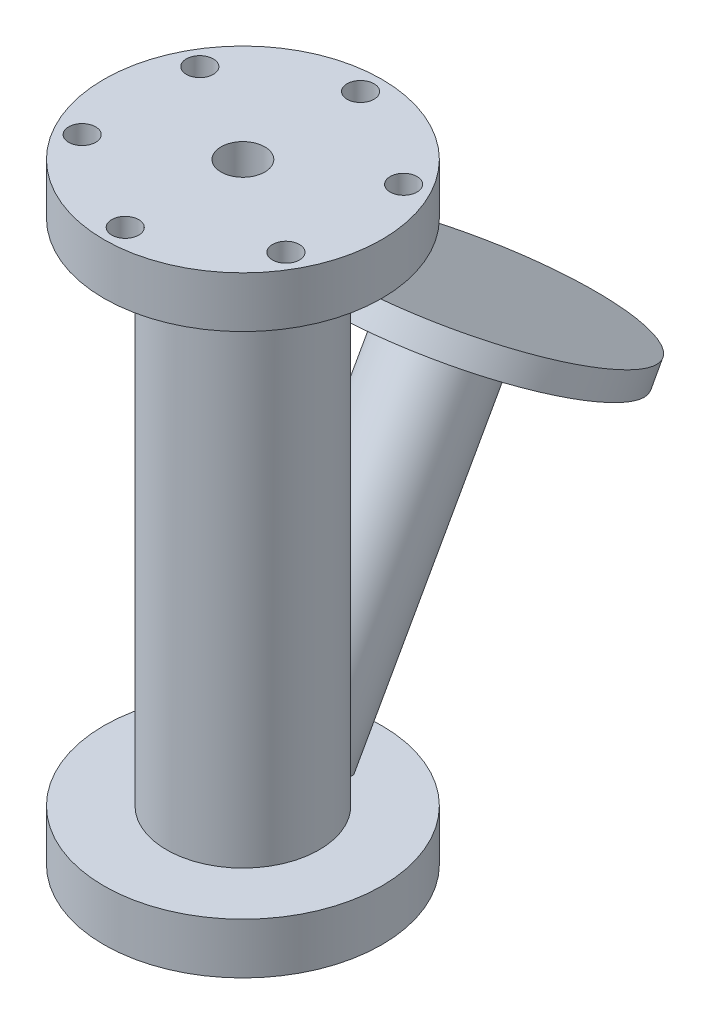
from build123d import *

# Parameters (mm, degrees)
SKETCH1_R         = 19.05
SKETCH1_R_2       = 5.461
EXTRUDE1_DEPTH    = 152.4
SKETCH2_R         = 34.671
SKETCH2_R_2       = 16.51
EXTRUDE2_DEPTH    = 12.7
EXTRUDE3_START    = -12.7
SKETCH3_R         = 34.671
SKETCH3_R_2       = 16.51
EXTRUDE3_DEPTH    = 12.7
SKETCH4_R         = 3.3655
EXTRUDE4_DEPTH    = 149.05487659
CIRPATTERN1_COUNT = 6
SKETCH11_R        = 37.719
EXTRUDE9_DEPTH    = 6.35
SKETCH12_R        = 12.7
EXTRUDE10_DEPTH   = 90.17


with BuildPart() as part:
    # Sketch1 → Extrude1 (new body)
    with BuildSketch(Plane(origin=(0, 0, 0), x_dir=(1, 0, 0), z_dir=(0, 1, 0))):
        Circle(SKETCH1_R)
        Circle(SKETCH1_R_2, mode=Mode.SUBTRACT)
    extrude(amount=EXTRUDE1_DEPTH)

    # Sketch2 → Extrude2 (add)
    with BuildSketch(Plane.XZ):
        Circle(SKETCH2_R)
        Circle(SKETCH2_R_2, mode=Mode.SUBTRACT)
    extrude(amount=-EXTRUDE2_DEPTH)

    # Sketch3 → Extrude3 (add)
    with BuildSketch(Plane(origin=(0, 152.4, 0), x_dir=(1, 0, 0), z_dir=(0, 1, 0)).offset(EXTRUDE3_START)):
        Circle(SKETCH3_R)
        Circle(SKETCH3_R_2, mode=Mode.SUBTRACT)
    extrude(amount=EXTRUDE3_DEPTH)

    # Sketch4 → Extrude4 (cut, through all)
    with BuildSketch(Plane(origin=(0, 139.7, 0), x_dir=(-1, 0, 0), z_dir=(0, -1, 0))):
        with Locations((0, 29.3624)):
            Circle(SKETCH4_R)
    extrude4 = extrude(amount=-EXTRUDE4_DEPTH, mode=Mode.SUBTRACT)

    # CirPattern1: Extrude4 ×6 about axis
    cirpattern1_axis = Axis((0, 152.4, 0), (0, -1, 0))
    for i in range(1, CIRPATTERN1_COUNT):
        add(extrude4.rotate(cirpattern1_axis, i * 360 / CIRPATTERN1_COUNT), mode=Mode.SUBTRACT)

    # Sketch11 → Extrude9 (add)
    with BuildSketch(Plane(origin=(0, 98.400836825, -54.952251157), x_dir=(-1, 0, 0), z_dir=(0, 0.873081175094353, -0.4875748780401465))):
        Circle(SKETCH11_R)
    extrude(amount=-EXTRUDE9_DEPTH)

    # Sketch12 → Extrude10 (add)
    with BuildSketch(Plane(origin=(0, 98.400836825, -54.952251157), x_dir=(1, 0, 0), z_dir=(0, 0.8730811750943531, -0.48757487804014654))):
        Circle(SKETCH12_R)
    extrude(amount=-EXTRUDE10_DEPTH)


solid = part.part
